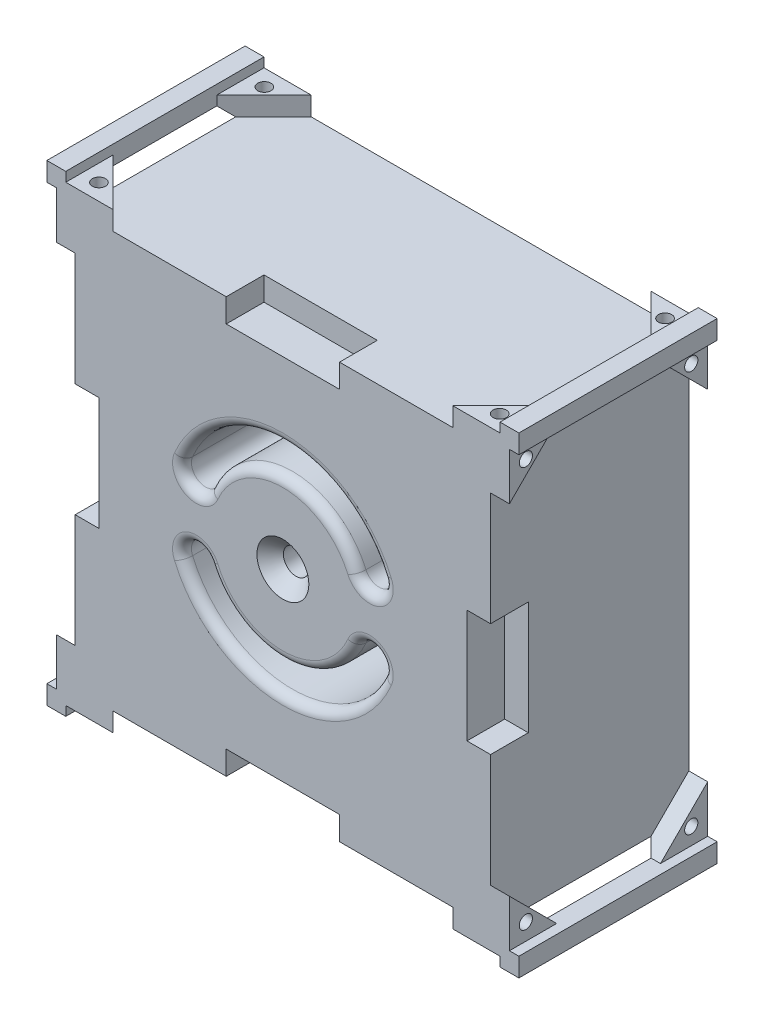
from build123d import *

# Parameters (mm, degrees)
SKIZZE1_W                                           = 50
SKIZZE1_H                                           = 50
SKIZZE1_R                                           = 18.55
AUFSATZ_LINEAR_AUSTRAGEN1_DEPTH                     = 21
SKIZZE2_W                                           = 50
SKIZZE2_H                                           = 50
AUFSATZ_LINEAR_AUSTRAGEN2_DEPTH                     = 3
FORMSENKUNG_F_R_M2_5_LINSENSENKSCHRAUBE_D           = 2.7
FORMSENKUNG_F_R_M2_5_LINSENSENKSCHRAUBE_CSINK_D     = 5.5
FORMSENKUNG_F_R_M2_5_LINSENSENKSCHRAUBE_CSINK_ANGLE = 90
SKIZZE5_W                                           = 21
SKIZZE5_H                                           = 46
SCHNITT_LINEAR_AUSTRAGEN1_DEPTH                     = 1
SCHNITT_LINEAR_AUSTRAGEN2_DEPTH                     = 2
SKIZZE7_W                                           = 8
SKIZZE7_H                                           = 12
SCHNITT_LINEAR_AUSTRAGEN3_DEPTH                     = 2.5
KREISMUSTER1_COUNT                                  = 4
SKIZZE8_R                                           = 5
SKIZZE8_R_2                                         = 2.25
AUFSATZ_LINEAR_AUSTRAGEN3_DEPTH                     = 3
FASE1_SIZE                                          = 0.2
FASE1_SIZE2                                         = 0.746410162
SKIZZE10_R                                          = 0.7
SCHNITT_LINEAR_AUSTRAGEN4_DEPTH                     = 5
KREISMUSTER2_COUNT                                  = 4
SCHNITT_LINEAR_START                                = -0.5
SKIZZE12_R                                          = 17.05
SKIZZE12_R_2                                        = 5
SCHNITT_LINEAR_AUSTRAGEN7_DEPTH                     = 0.5
SCHNITT_LINEAR_AUSTRAGEN8_DEPTH                     = 42.12177039
VERRUNDUNG1_R                                       = 1


# Read off the part's stored shape, not the designer's step: Fläche verschieben1
with BuildPart() as part:
    # Skizze1 → Aufsatz-Linear austragen1 (new body)
    with BuildSketch(Plane.XY):
        Rectangle(SKIZZE1_W, SKIZZE1_H)
        with Locations(Location((0, 0, 0), (0, 0, 180))):
            Circle(SKIZZE1_R, mode=Mode.SUBTRACT)
    extrude(amount=AUFSATZ_LINEAR_AUSTRAGEN1_DEPTH)

    # Skizze2 → Aufsatz-Linear austragen2 (add)
    with BuildSketch(Plane.XY.offset(21)):
        Rectangle(SKIZZE2_W, SKIZZE2_H)
    extrude(amount=-AUFSATZ_LINEAR_AUSTRAGEN2_DEPTH)

    # Formsenkung für M2.5 Linsensenkschraube mit Schlitz1 (through all)
    with Locations(Plane.XY.offset(21)):
        with Locations((0, 0)):
            CounterSinkHole(FORMSENKUNG_F_R_M2_5_LINSENSENKSCHRAUBE_D / 2, FORMSENKUNG_F_R_M2_5_LINSENSENKSCHRAUBE_CSINK_D / 2, counter_sink_angle=FORMSENKUNG_F_R_M2_5_LINSENSENKSCHRAUBE_CSINK_ANGLE)

    # Skizze5 → Schnitt-Linear austragen1 (cut)
    with BuildSketch(Plane(origin=(25, 0, 0), x_dir=(0, 0, -1), z_dir=(1, 0, 0))):
        with Locations((-10.5, 0)):
            Rectangle(SKIZZE5_W, SKIZZE5_H)
    schnitt_linear_austragen1 = extrude(amount=-SCHNITT_LINEAR_AUSTRAGEN1_DEPTH, mode=Mode.SUBTRACT)

    # Skizze6 → Schnitt-Linear austragen2 (cut)
    with BuildSketch(Plane(origin=(24, 0, 0), x_dir=(0, 0, -1), z_dir=(1, 0, 0))):
        Polygon((-16, 23), (-21, 18), (-21, -18), (-16, -23), (-5, -23), (0, -18), (0, 18), (-5, 23), align=None)
    schnitt_linear_austragen2 = extrude(amount=-SCHNITT_LINEAR_AUSTRAGEN2_DEPTH, mode=Mode.SUBTRACT)

    # Skizze7 → Schnitt-Linear austragen3 (cut)
    with BuildSketch(Plane(origin=(22, 0, 0), x_dir=(0, 0, -1), z_dir=(1, 0, 0))):
        with Locations((-21, 0)):
            Rectangle(SKIZZE7_W, SKIZZE7_H)
    schnitt_linear_austragen3 = extrude(amount=-SCHNITT_LINEAR_AUSTRAGEN3_DEPTH, mode=Mode.SUBTRACT)

    # Kreismuster1: Schnitt-Linear austragen1, Schnitt-Linear austragen2, Schnitt-Linear austragen3 ×4 about axis
    kreismuster1_axis = Axis((0, 0, 0), (0, 0, 1))
    add([schnitt_linear_austragen1.rotate(kreismuster1_axis, i * 360 / KREISMUSTER1_COUNT) for i in range(1, KREISMUSTER1_COUNT)], mode=Mode.SUBTRACT)
    add([schnitt_linear_austragen2.rotate(kreismuster1_axis, i * 360 / KREISMUSTER1_COUNT) for i in range(1, KREISMUSTER1_COUNT)], mode=Mode.SUBTRACT)
    add([schnitt_linear_austragen3.rotate(kreismuster1_axis, i * 360 / KREISMUSTER1_COUNT) for i in range(1, KREISMUSTER1_COUNT)], mode=Mode.SUBTRACT)

    # Skizze8 → Aufsatz-Linear austragen3 (add)
    with BuildSketch(Plane(origin=(0, 0, 18), x_dir=(-1, 0, 0), z_dir=(0, 0, -1))):
        with Locations(Location((0, 0, 0), (0, 0, 180))):
            Circle(SKIZZE8_R)
        Circle(SKIZZE8_R_2, mode=Mode.SUBTRACT)
    extrude(amount=AUFSATZ_LINEAR_AUSTRAGEN3_DEPTH)

    # Fase1
    fase1_edges = [part.edges().sort_by_distance(p)[0] for p in [
        (2.25, 0, 15),
    ]]
    fase1_side = [part.faces().sort_by_distance(p)[0] for p in [
        (-4.858578644, 0, 15),
    ]]
    chamfer(fase1_edges, length=FASE1_SIZE, length2=FASE1_SIZE2, reference=fase1_side[0])

    # Skizze10 → Schnitt-Linear austragen4 (cut)
    with BuildSketch(Plane(origin=(0, -24, 0), x_dir=(-1, 0, 0), z_dir=(0, -1, 0))):
        with Locations(Location((-21.225, -1.74, 0), (0, 0, 180))):
            Circle(SKIZZE10_R)
        with Locations(Location((21.225, -1.74, 0), (0, 0, 180))):
            Circle(SKIZZE10_R)
        with Locations(Location((21.225, -19.26, 0), (0, 0, 180))):
            Circle(SKIZZE10_R)
        with Locations(Location((-21.225, -19.26, 0), (0, 0, 180))):
            Circle(SKIZZE10_R)
    schnitt_linear_austragen4 = extrude(amount=-SCHNITT_LINEAR_AUSTRAGEN4_DEPTH, mode=Mode.SUBTRACT)

    # Kreismuster2: Schnitt-Linear austragen4 ×4 about axis
    kreismuster2_axis = Axis((0, 0, 0), (0, 0, 1))
    for i in range(1, KREISMUSTER2_COUNT):
        add(schnitt_linear_austragen4.rotate(kreismuster2_axis, i * 360 / KREISMUSTER2_COUNT), mode=Mode.SUBTRACT)

    # Skizze12 → Schnitt-Linear austragen7 (cut)
    with BuildSketch(Plane(origin=(0, 0, 18), x_dir=(-1, 0, 0), z_dir=(0, 0, -1)).offset(SCHNITT_LINEAR_START)):
        Circle(SKIZZE12_R)
        Circle(SKIZZE12_R_2, mode=Mode.SUBTRACT)
    extrude(amount=SCHNITT_LINEAR_AUSTRAGEN7_DEPTH, mode=Mode.SUBTRACT)

    # Fläche verschieben1 outline → Fläche verschieben1 (revolve)
    with BuildSketch(Plane.XZ):
        Polygon((1.35, 18), (1.35, 7), (2.25, 7), (2.25, 4.746410162), (2.45, 4), (5, 4), (5, 7.5), (17.05, 7.5), (17.05, 7), (18.55, 7), (18.55, 18), (17.05, 18), (17.05, 18.5), (5, 18.5), (5, 15), (2.45, 15), (2.25, 15.746410162), (2.25, 18), align=None)
    revolve(axis=Axis((0, 0, 0), (0, 0, 1)))

    # Skizze13 → Schnitt-Linear austragen8 (cut, through all)
    with BuildSketch(Plane.XY.offset(21)):
        with BuildLine():
            ThreePointArc((10.564832878, 4.5425), (0, 11.5), (-10.564832878, 4.5425))
            ThreePointArc((-10.564832878, 4.5425), (-9.779311199, 2.57197832), (-7.808789519, 3.3575))
            ThreePointArc((-7.808789519, 3.3575), (0, 8.5), (7.808789519, 3.3575))
            ThreePointArc((7.808789519, 3.3575), (9.779311199, 2.57197832), (10.564832878, 4.5425))
        make_face()
        with BuildLine():
            ThreePointArc((10.564832878, -4.5425), (0, -11.5), (-10.564832878, -4.5425))
            ThreePointArc((-10.564832878, -4.5425), (-9.779311199, -2.57197832), (-7.808789519, -3.3575))
            ThreePointArc((-7.808789519, -3.3575), (0, -8.5), (7.808789519, -3.3575))
            ThreePointArc((7.808789519, -3.3575), (9.779311199, -2.57197832), (10.564832878, -4.5425))
        make_face()
    extrude(amount=-SCHNITT_LINEAR_AUSTRAGEN8_DEPTH, mode=Mode.SUBTRACT)

    # Verrundung1
    verrundung1_edges = [part.edges().sort_by_distance(p)[0] for p in [
        (9.779311199, 2.57197832, 21),
        (0, 11.5, 21),
        (-9.779311199, 2.57197832, 21),
        (0, 8.5, 21),
        (9.779311199, -2.57197832, 21),
        (0, -8.5, 21),
        (-9.779311199, -2.57197832, 21),
        (0, -11.5, 21),
    ]]
    fillet(verrundung1_edges, radius=VERRUNDUNG1_R)


solid = part.part
